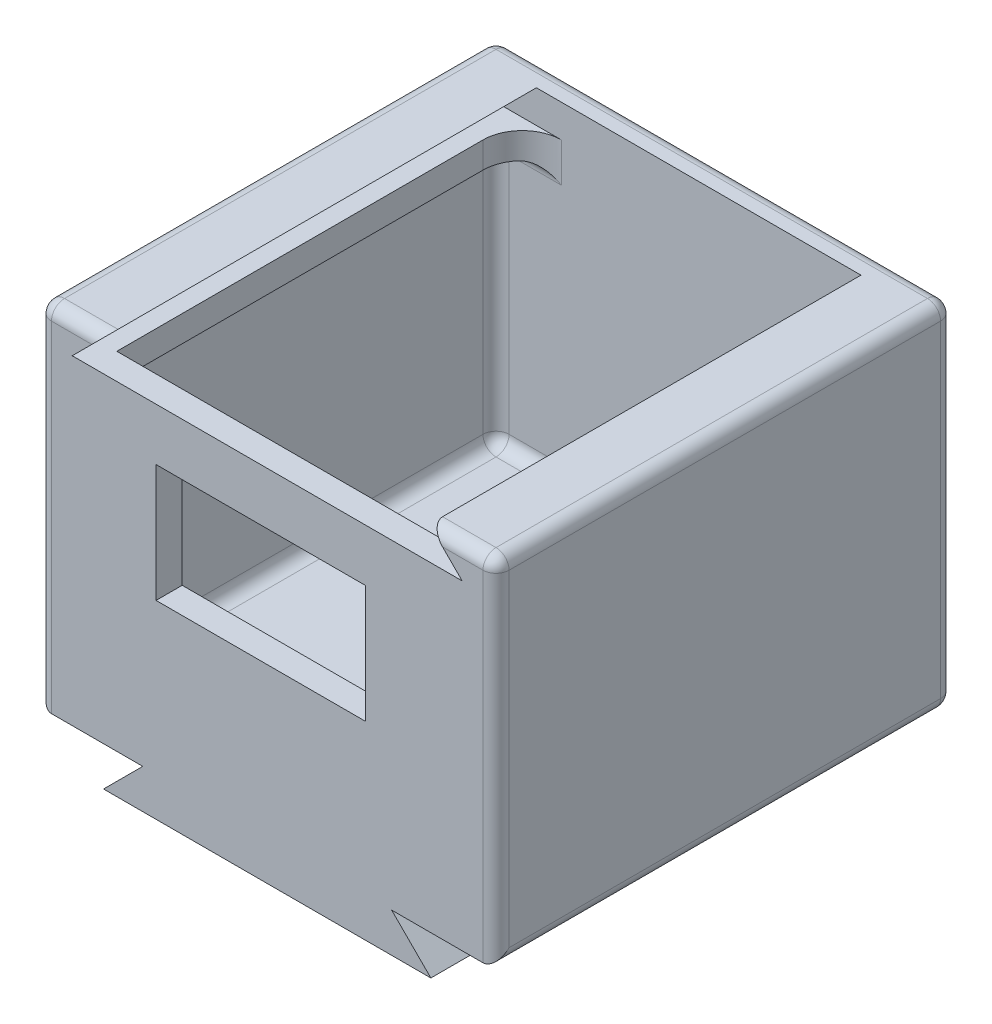
from build123d import *

# Parameters (mm, degrees)
SKETCH1_W           = 35
SKETCH1_H           = 35
BOSS_EXTRUDE1_DEPTH = 27
SHELL1_T            = -2
CUT_EXTRUDE7_DEPTH  = 33
BOSS_EXTRUDE4_DEPTH = 31
BOSS_EXTRUDE3_DEPTH = 26
FILLET1_R           = 1
FILLET2_R           = 1
FILLET3_R           = 1
FILLET4_R           = 1
SKETCH10_R          = 1.65
CUT_EXTRUDE3_DEPTH  = 36.178118199
SKETCH11_W          = 16
SKETCH11_H          = 9
CUT_EXTRUDE4_DEPTH  = 2
SKETCH13_R          = 2.6
CUT_EXTRUDE6_DEPTH  = 2
FILLET5_R           = 3
FILLET6_R           = 1


with BuildPart() as part:
    # Sketch1 → Boss-Extrude1 (new body)
    with BuildSketch(Plane(origin=(0, 0, 0), x_dir=(1, 0, 0), z_dir=(0, 1, 0))):
        Rectangle(SKETCH1_W, SKETCH1_H)
    extrude(amount=BOSS_EXTRUDE1_DEPTH)

    # Shell1
    shell1_openings = [part.faces().sort_by_distance(p)[0] for p in [
        (0, 27, 0),
    ]]
    offset(amount=SHELL1_T, openings=shell1_openings, kind=Kind.INTERSECTION)

    # Sketch5 → Cut-Extrude7 (cut)
    with BuildSketch(Plane.XY.offset(17.5)):
        Polygon((-12.412133126, 27), (12.412133126, 27), (14.912133126, 24.5), (-14.912133126, 24.5), align=None)
    extrude(amount=-CUT_EXTRUDE7_DEPTH, mode=Mode.SUBTRACT)

    # Sketch16 → Boss-Extrude4 (add)
    with BuildSketch(Plane(origin=(0, 0, 15.5), x_dir=(-1, 0, 0), z_dir=(0, 0, -1))):
        Polygon((-15.5, 27), (-12.412133126, 27), (-14.912133126, 24.5), (-13.5, 24.5), (-13.5, 22.5), (-15.5, 22.5), align=None)
        Polygon((13.5, 22.5), (15.5, 22.5), (15.5, 27), (12.412133126, 27), (14.912133126, 24.5), (13.5, 24.5), align=None)
    extrude(amount=BOSS_EXTRUDE4_DEPTH)

    # Sketch9 → Boss-Extrude3 (add)
    with BuildSketch(Plane.XY.offset(17.5)):
        Polygon((-9.517157288, 0), (-12.517157288, -3), (12.517157288, -3), (9.517157288, 0), align=None)
    extrude(amount=-BOSS_EXTRUDE3_DEPTH)

    # Fillet1
    fillet1_edges = [part.edges().sort_by_distance(p)[0] for p in [
        (15.5, 2, 0),
        (0, 2, -15.5),
        (-15.5, 2, 0),
        (0, 2, 15.5),
        (15.5, 12.25, 15.5),
        (15.5, 12.25, -15.5),
        (-15.5, 12.25, -15.5),
        (-15.5, 12.25, 15.5),
    ]]
    fillet(fillet1_edges, radius=FILLET1_R)

    # Fillet2
    fillet2_edges = [part.edges().sort_by_distance(p)[0] for p in [
        (-17.5, 27, 0),
        (17.5, 27, 0),
        (-17.5, 0, 0),
        (17.5, 0, 0),
        (17.5, 13.5, 17.5),
        (-17.5, 13.5, 17.5),
        (-17.5, 13.5, -17.5),
        (17.5, 13.5, -17.5),
    ]]
    fillet(fillet2_edges, radius=FILLET2_R)

    # Fillet3
    # the kernel refuses this fillet: 1 mm, written as the material it takes off along each edge
    with BuildSketch(Plane(origin=(16.5, 26, -16.5), x_dir=(0, 0, -1), z_dir=(0, 1, 0))) as fillet3_piece_1_section:
        Polygon((0, 0), (FILLET3_R, 0), (FILLET3_R, -FILLET3_R), (0, -FILLET3_R), align=None)
    fillet3_piece_1 = extrude(amount=FILLET3_R, mode=Mode.PRIVATE)
    fillet3_piece_1 = fillet3_piece_1 - Plane(origin=(16.5, 26, -16.5), x_dir=(-0.7071067811865475, 0, 0.7071067811865475), z_dir=(0, 1, 0)) * Sphere(FILLET3_R, mode=Mode.PRIVATE)
    add(fillet3_piece_1, mode=Mode.SUBTRACT)
    with BuildSketch(Plane(origin=(16.5, 1, -16.5), x_dir=(0, -1, 0), z_dir=(0, 0, -1))) as fillet3_piece_2_section:
        Polygon((0, 0), (FILLET3_R, 0), (FILLET3_R, -FILLET3_R), (0, -FILLET3_R), align=None)
    fillet3_piece_2 = extrude(amount=FILLET3_R, mode=Mode.PRIVATE)
    fillet3_piece_2 = fillet3_piece_2 - Plane(origin=(16.5, 1, -16.5), x_dir=(-0.7071067811865475, 0.7071067811865475, 0), z_dir=(0, 0, -1)) * Sphere(FILLET3_R, mode=Mode.PRIVATE)
    add(fillet3_piece_2, mode=Mode.SUBTRACT)
    with BuildSketch(Plane(origin=(-16.5, 26, -16.5), x_dir=(0, 0, -1), z_dir=(0, 1, 0))) as fillet3_piece_3_section:
        Polygon((0, 0), (FILLET3_R, 0), (FILLET3_R, FILLET3_R), (0, FILLET3_R), align=None)
    fillet3_piece_3 = extrude(amount=FILLET3_R, mode=Mode.PRIVATE)
    fillet3_piece_3 = fillet3_piece_3 - Plane(origin=(-16.5, 26, -16.5), x_dir=(0.7071067811865475, 0, 0.7071067811865475), z_dir=(0, 1, 0)) * Sphere(FILLET3_R, mode=Mode.PRIVATE)
    add(fillet3_piece_3, mode=Mode.SUBTRACT)
    with BuildSketch(Plane(origin=(-16.5, 1, -16.5), x_dir=(0, -1, 0), z_dir=(0, 0, -1))) as fillet3_piece_4_section:
        Polygon((0, 0), (FILLET3_R, 0), (FILLET3_R, FILLET3_R), (0, FILLET3_R), align=None)
    fillet3_piece_4 = extrude(amount=FILLET3_R, mode=Mode.PRIVATE)
    fillet3_piece_4 = fillet3_piece_4 - Plane(origin=(-16.5, 1, -16.5), x_dir=(0.7071067811865475, 0.7071067811865475, 0), z_dir=(0, 0, -1)) * Sphere(FILLET3_R, mode=Mode.PRIVATE)
    add(fillet3_piece_4, mode=Mode.SUBTRACT)
    with BuildSketch(Plane(origin=(16.5, 27, -17.5), x_dir=(0, 0, 1), z_dir=(-1, 0, 0)), Plane(origin=(16.5, 0, -17.5), x_dir=(0, 1, 0), z_dir=(-1, 0, 0))) as fillet3_piece_5:
        with BuildLine():
            CenterArc((FILLET3_R, -FILLET3_R), FILLET3_R, 90, 90)
            Line((0, -FILLET3_R), (0, 0))
            Line((0, 0), (FILLET3_R, 0))
        make_face()
    extrude(amount=33, mode=Mode.SUBTRACT)

    # Fillet4
    # the kernel refuses this fillet: 1 mm, written as the material it takes off along each edge
    with BuildSketch(Plane(origin=(16.5, 26, 16.5), x_dir=(0, 0, 1), z_dir=(0, 1, 0))) as fillet4_piece_1_section:
        Polygon((0, 0), (FILLET4_R, 0), (FILLET4_R, FILLET4_R), (0, FILLET4_R), align=None)
    fillet4_piece_1 = extrude(amount=FILLET4_R, mode=Mode.PRIVATE)
    fillet4_piece_1 = fillet4_piece_1 - Plane(origin=(16.5, 26, 16.5), x_dir=(-0.7071067811865475, 0, -0.7071067811865475), z_dir=(0, 1, 0)) * Sphere(FILLET4_R, mode=Mode.PRIVATE)
    add(fillet4_piece_1, mode=Mode.SUBTRACT)
    with BuildSketch(Plane(origin=(-16.5, 26, 16.5), x_dir=(0, 0, 1), z_dir=(0, 1, 0))) as fillet4_piece_2_section:
        Polygon((0, 0), (FILLET4_R, 0), (FILLET4_R, -FILLET4_R), (0, -FILLET4_R), align=None)
    fillet4_piece_2 = extrude(amount=FILLET4_R, mode=Mode.PRIVATE)
    fillet4_piece_2 = fillet4_piece_2 - Plane(origin=(-16.5, 26, 16.5), x_dir=(0.7071067811865475, 0, -0.7071067811865475), z_dir=(0, 1, 0)) * Sphere(FILLET4_R, mode=Mode.PRIVATE)
    add(fillet4_piece_2, mode=Mode.SUBTRACT)
    with BuildSketch(Plane(origin=(-16.5, 27, 17.5), x_dir=(0, 0, -1), z_dir=(1, 0, 0)), Plane(origin=(9.912133126, 27, 17.5), x_dir=(0, 0, -1), z_dir=(1, 0, 0))) as fillet4_piece_3:
        with BuildLine():
            CenterArc((FILLET4_R, -FILLET4_R), FILLET4_R, 90, 90)
            Line((0, -FILLET4_R), (0, 0))
            Line((0, 0), (FILLET4_R, 0))
        make_face()
    extrude(amount=6.587866874, mode=Mode.SUBTRACT)

    # Sketch10 → Cut-Extrude3 (cut, through all)
    with BuildSketch(Plane(origin=(0, 2, 0), x_dir=(1, 0, 0), z_dir=(0, 1, 0))):
        with Locations(Location((-7.5, -9.5, 0), (0, 0, 270))):
            Circle(SKETCH10_R)
        with Locations(Location((7.5, -9.5, 0), (0, 0, 270))):
            Circle(SKETCH10_R)
    extrude(amount=-CUT_EXTRUDE3_DEPTH, mode=Mode.SUBTRACT)

    # Sketch11 → Cut-Extrude4 (cut)
    with BuildSketch(Plane(origin=(0, 0, 17.5), x_dir=(-1, 0, 0), z_dir=(0, 0, -1))):
        with Locations((0.5, 16)):
            Rectangle(SKETCH11_W, SKETCH11_H)
    extrude(amount=CUT_EXTRUDE4_DEPTH, mode=Mode.SUBTRACT)

    # Sketch13 → Cut-Extrude6 (cut)
    with BuildSketch(Plane.XZ.offset(3)):
        with Locations((-7.5, 9.5)):
            Circle(SKETCH13_R)
        with Locations((7.5, 9.5)):
            Circle(SKETCH13_R)
    extrude(amount=-CUT_EXTRUDE6_DEPTH, mode=Mode.SUBTRACT)

    # Fillet5
    fillet5_edges = [part.edges().sort_by_distance(p)[0] for p in [
        (13.5, 23.5, -15.5),
        (-13.5, 23.5, -15.5),
    ]]
    fillet(fillet5_edges, radius=FILLET5_R)

    # Fillet6
    fillet6_edges = [part.edges().sort_by_distance(p)[0] for p in [
        (-15.207106781, 22.5, -15.207106781),
        (-15.207106781, 22.5, 15.207106781),
        (15.5, 22.5, 0),
        (15.207106781, 22.5, 15.207106781),
        (15.207106781, 22.5, -15.207106781),
        (12.5, 22.5, -15.5),
        (-14, 22.5, 15.5),
        (-15.5, 22.5, 0),
        (14, 22.5, 15.5),
        (-12.5, 22.5, -15.5),
    ]]
    fillet(fillet6_edges, radius=FILLET6_R)


solid = part.part
